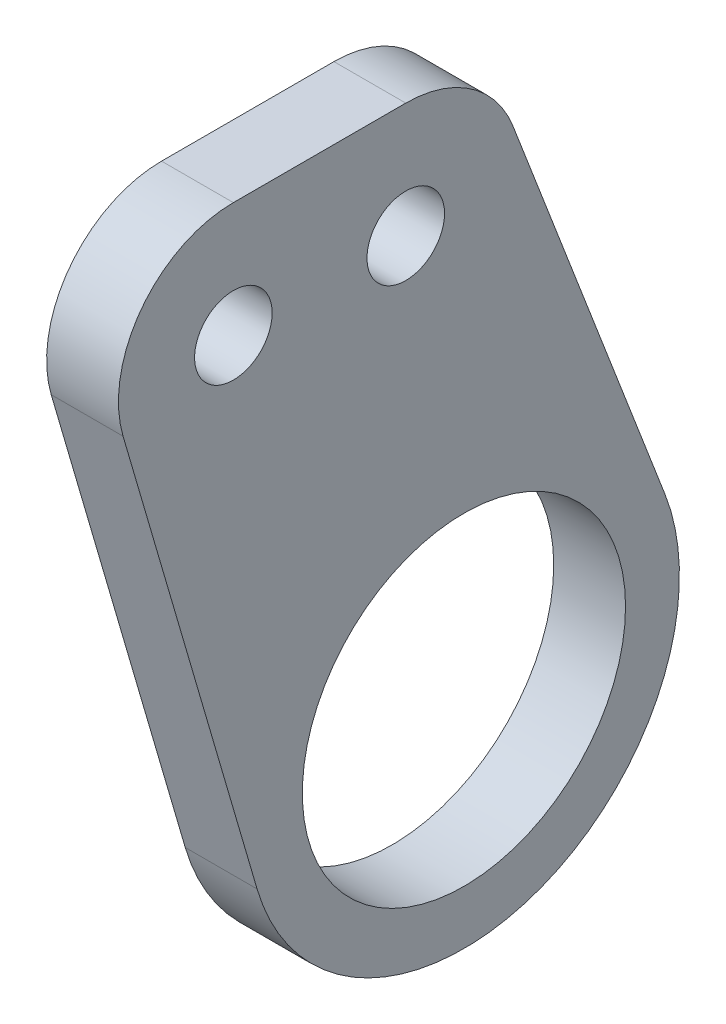
from build123d import *

# Parameters (mm, degrees)
BOSS_EXTRUDE1_DEPTH      = 3.175
BOSS_EXTRUDE1_DEPTH_BACK = 3.175
SKETCH1_R                = 14.2875
SKETCH1_R_2              = 3.429


with BuildPart() as part:
    # Sketch1 → Boss-Extrude1 (new, two sides: drawn at the far end of the back side and taken through both)
    with BuildSketch(Plane(origin=(0, 0, 0), x_dir=(0, 0, -1), z_dir=(1, 0, 0)).offset(-BOSS_EXTRUDE1_DEPTH_BACK)):
        with BuildLine():
            Line((-20.3835, 48.26), (-5.1435, 48.26))
            ThreePointArc((-5.1435, 48.26), (0.606928002, 46.476047862), (4.337968538, 41.750664919))
            Line((4.337968538, 41.750664919), (17.77775351, 6.844996724))
            ThreePointArc((17.77775351, 6.844996724), (6.097008594, -18.047963492), (-18.286717832, -5.33839404))
            Line((-18.286717832, -5.33839404), (-30.136416177, 35.252856512))
            ThreePointArc((-30.136416177, 35.252856512), (-28.512232307, 44.195023468), (-20.3835, 48.26))
        make_face()
        Circle(SKETCH1_R, mode=Mode.SUBTRACT)
        with Locations((-20.3835, 38.1)):
            Circle(SKETCH1_R_2, mode=Mode.SUBTRACT)
        with Locations((-5.1435, 38.1)):
            Circle(SKETCH1_R_2, mode=Mode.SUBTRACT)
    extrude(amount=BOSS_EXTRUDE1_DEPTH + BOSS_EXTRUDE1_DEPTH_BACK)


solid = part.part
